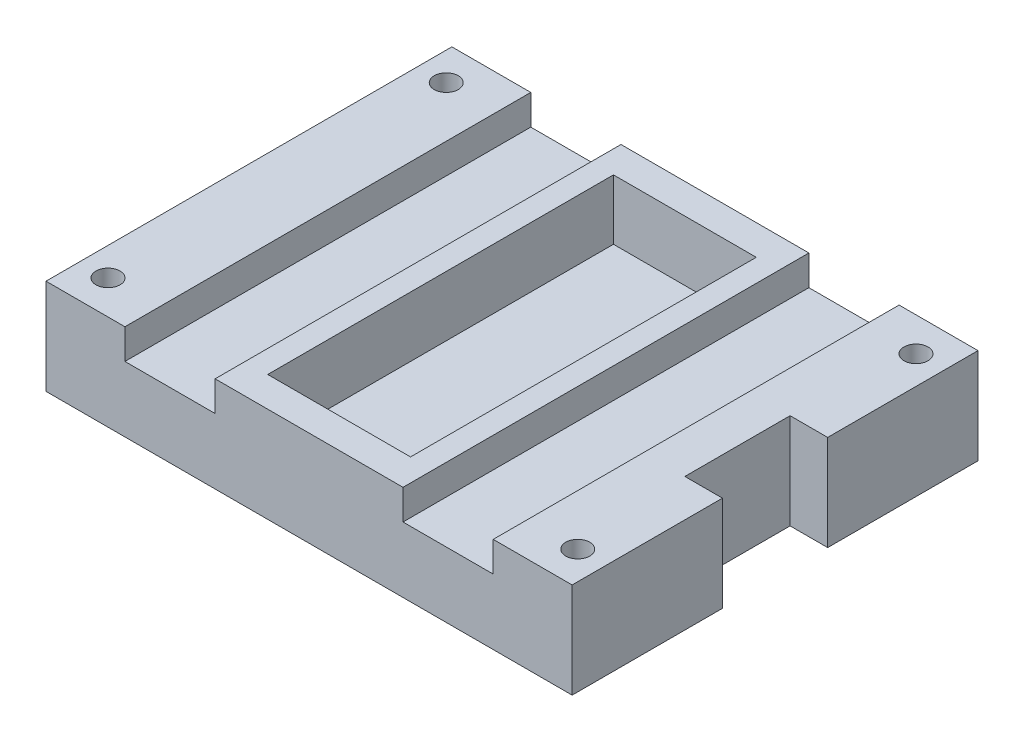
from build123d import *

# Parameters (mm, degrees)
RESSALTO_EXTRUS_O1_DEPTH    = 98
ESBO_O4_W                   = 33
ESBO_O4_H                   = 22
CORTE_EXTRUS_O3_DEPTH       = 25
ESBO_O10_W                  = 12
ESBO_O10_H                  = 4
CORTE_EXTRUS_O8_DEPTH       = 122.545423608
ESBO_O11_R                  = 1.6
CORTE_EXTRUS_O9_DEPTH       = 20
ESBO_O15_W                  = 4
ESBO_O15_H                  = 22
CORTE_EXTRUS_O11_DEPTH      = 137.386546257
CORTE_EXTRUS_O12_DEPTH      = 10
CORTE_EXTRUS_O12_DEPTH_BACK = 41
ESBO_O16_W                  = 5
ESBO_O16_H                  = 14
ESBO_O17_W                  = 11.435879356
ESBO_O17_H                  = 99.573316557
CORTE_EXTRUS_O13_DEPTH      = 20
ESBO_O18_W                  = 19
ESBO_O18_H                  = 46
CORTE_EXTRUS_O14_DEPTH      = 8


with BuildPart() as part:
    # Esboço1 → Ressalto-extrusão1 (new body)
    with BuildSketch(Plane.XY):
        Polygon((0, 0), (94, 0), (75.862520314, 12.7), (0, 12.7), align=None)
    extrude(amount=RESSALTO_EXTRUS_O1_DEPTH)

    # Esboço4 → Corte-extrusão3 (cut)
    with BuildSketch(Plane(origin=(0, 12.7, 0), x_dir=(1, 0, 0), z_dir=(0, 1, 0))):
        with Locations((16.5, -87)):
            Rectangle(ESBO_O4_W, ESBO_O4_H)
        with Locations((16.5, -11)):
            Rectangle(ESBO_O4_W, ESBO_O4_H)
        with Locations((53.5, -87)):
            Rectangle(ESBO_O4_W, ESBO_O4_H)
        with Locations((53.5, -11)):
            Rectangle(ESBO_O4_W, ESBO_O4_H)
    extrude(amount=-CORTE_EXTRUS_O3_DEPTH, mode=Mode.SUBTRACT)

    # Esboço10 → Corte-extrusão8 (cut, through all)
    with BuildSketch(Plane.XY.offset(76)):
        with Locations((16.5, 10.7)):
            Rectangle(ESBO_O10_W, ESBO_O10_H)
        with Locations((53.5, 10.7)):
            Rectangle(ESBO_O10_W, ESBO_O10_H)
    extrude(amount=-CORTE_EXTRUS_O8_DEPTH, mode=Mode.SUBTRACT)

    # Esboço11 → Corte-extrusão9 (cut)
    with BuildSketch(Plane(origin=(0, 12.7, 0), x_dir=(1, 0, 0), z_dir=(0, 1, 0))):
        with Locations((3.75, -71.5)):
            Circle(ESBO_O11_R)
        with Locations((3.75, -26.5)):
            Circle(ESBO_O11_R)
        with Locations((66.25, -26.5)):
            Circle(ESBO_O11_R)
        with Locations((66.25, -71.5)):
            Circle(ESBO_O11_R)
    extrude(amount=-CORTE_EXTRUS_O9_DEPTH, mode=Mode.SUBTRACT)

    # Esboço15 → Corte-extrusão11 (cut, through all)
    with BuildSketch(Plane(origin=(0, 12.7, 0), x_dir=(1, 0, 0), z_dir=(0, 1, 0))):
        with Locations((35, -11)):
            Rectangle(ESBO_O15_W, ESBO_O15_H)
        with Locations((35, -87)):
            Rectangle(ESBO_O15_W, ESBO_O15_H)
    extrude(amount=-CORTE_EXTRUS_O11_DEPTH, mode=Mode.SUBTRACT)

    # Esboço16 → Corte-extrusão12 (cut, two sides: drawn at the far end of the back side and taken through both)
    with BuildSketch(Plane(origin=(0, 12.7, 0), x_dir=(1, 0, 0), z_dir=(0, 1, 0)).offset(-CORTE_EXTRUS_O12_DEPTH_BACK)):
        Polygon((95.832875802, -109.85505817), (95.832875802, 2.472968948), (70, 2.472968948), (70, 0), (75.862520314, 0), (75.862520314, -98), (70, -98), (70, -109.85505817), align=None)
        with Locations((67.5, -49)):
            Rectangle(ESBO_O16_W, ESBO_O16_H)
    extrude(amount=CORTE_EXTRUS_O12_DEPTH + CORTE_EXTRUS_O12_DEPTH_BACK, mode=Mode.SUBTRACT)

    # Esboço17 → Corte-extrusão13 (cut)
    with BuildSketch(Plane(origin=(0, 12.7, 0), x_dir=(1, 0, 0), z_dir=(0, 1, 0))):
        with Locations((75.717939678, -49.786658279)):
            Rectangle(ESBO_O17_W, ESBO_O17_H)
    extrude(amount=-CORTE_EXTRUS_O13_DEPTH, mode=Mode.SUBTRACT)

    # Esboço18 → Corte-extrusão14 (cut)
    with BuildSketch(Plane(origin=(0, 12.7, 0), x_dir=(1, 0, 0), z_dir=(0, 1, 0))):
        with Locations((35, -49)):
            Rectangle(ESBO_O18_W, ESBO_O18_H)
    extrude(amount=-CORTE_EXTRUS_O14_DEPTH, mode=Mode.SUBTRACT)


solid = part.part
